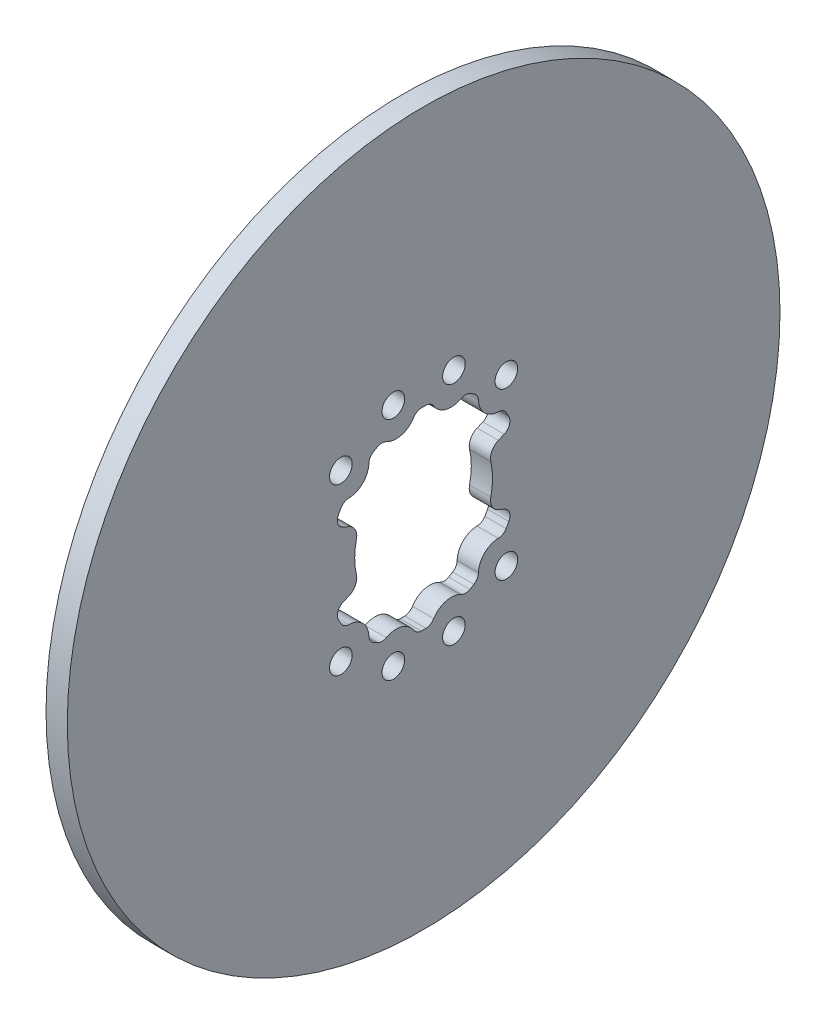
from build123d import *

# Parameters (mm, degrees)
SKETCH1_R           = 106.3625
BOSS_EXTRUDE1_DEPTH = 6.35
SKETCH2_R           = 3.3782
CUT_EXTRUDE1_DEPTH  = 151.553264038


with BuildPart() as part:
    # Sketch1 → Boss-Extrude1 (new body)
    with BuildSketch(Plane(origin=(0, 0, 0), x_dir=(0, 0, -1), z_dir=(1, 0, 0))):
        Circle(SKETCH1_R)
    extrude(amount=BOSS_EXTRUDE1_DEPTH)

    # Sketch2 → Cut-Extrude1 (cut, through all)
    with BuildSketch(Plane(origin=(6.35, 0, 0), x_dir=(0, 0, -1), z_dir=(1, 0, 0))):
        with Locations((24.695704333, -24.695704333)):
            Circle(SKETCH2_R)
        with Locations((9.03925515, -33.734959483)):
            Circle(SKETCH2_R)
        with Locations((-9.03925515, -33.734959483)):
            Circle(SKETCH2_R)
        with Locations((-24.695704333, -24.695704333)):
            Circle(SKETCH2_R)
        with Locations((-24.695704333, 24.695704333)):
            Circle(SKETCH2_R)
        with Locations((-9.03925515, 33.734959483)):
            Circle(SKETCH2_R)
        with Locations((9.03925515, 33.734959483)):
            Circle(SKETCH2_R)
        with Locations((24.695704333, 24.695704333)):
            Circle(SKETCH2_R)
        with BuildLine():
            Line((22.309989371, -8.966172555), (24.035660602, -9.680968983))
            ThreePointArc((24.035660602, -9.680968983), (25.596901419, -11.320415271), (25.431134545, -13.578241298))
            ThreePointArc((25.431134545, -13.578241298), (25.029758681, -14.304629369), (24.607640645, -15.019163188))
            ThreePointArc((24.607640645, -15.019163188), (23.62126299, -15.982367595), (22.294378957, -16.356643388))
            ThreePointArc((22.294378957, -16.356643388), (18.140117365, -18.140117365), (16.356643388, -22.294378957))
            ThreePointArc((16.356643388, -22.294378957), (15.982367595, -23.62126299), (15.019163188, -24.607640645))
            ThreePointArc((15.019163188, -24.607640645), (14.4145, -24.966646366), (13.801260332, -25.310797187))
            ThreePointArc((13.801260332, -25.310797187), (12.465430022, -25.651767845), (11.129176844, -25.312458173))
            ThreePointArc((11.129176844, -25.312458173), (6.639743783, -24.779861148), (3.018079217, -27.485820232))
            ThreePointArc((3.018079217, -27.485820232), (2.030504855, -28.447797617), (0.703156542, -28.82042352))
            ThreePointArc((0.703156542, -28.82042352), (0, -28.829), (-0.703156542, -28.82042352))
            ThreePointArc((-0.703156542, -28.82042352), (-2.030504855, -28.447797617), (-3.018079217, -27.485820232))
            ThreePointArc((-3.018079217, -27.485820232), (-6.639743783, -24.779861148), (-11.129176844, -25.312458173))
            ThreePointArc((-11.129176844, -25.312458173), (-12.465430022, -25.651767845), (-13.801260332, -25.310797187))
            ThreePointArc((-13.801260332, -25.310797187), (-14.4145, -24.966646366), (-15.019163188, -24.607640645))
            ThreePointArc((-15.019163188, -24.607640645), (-15.982367595, -23.62126299), (-16.356643388, -22.294378957))
            ThreePointArc((-16.356643388, -22.294378957), (-18.140117365, -18.140117365), (-22.294378957, -16.356643388))
            ThreePointArc((-22.294378957, -16.356643388), (-23.62126299, -15.982367595), (-24.607640645, -15.019163188))
            ThreePointArc((-24.607640645, -15.019163188), (-25.029758681, -14.304629369), (-25.431134545, -13.578241298))
            ThreePointArc((-25.431134545, -13.578241298), (-25.596901419, -11.320415271), (-24.035660602, -9.680968983))
            Line((-24.035660602, -9.680968983), (-22.309989371, -8.966172555))
            ThreePointArc((-22.309989371, -8.966172555), (-20.38229114, -7.193471081), (-20.054261178, -4.595224108))
            ThreePointArc((-20.054261178, -4.595224108), (-20.574, 0), (-20.054261178, 4.595224108))
            ThreePointArc((-20.054261178, 4.595224108), (-20.38229114, 7.193471081), (-22.309989371, 8.966172555))
            Line((-22.309989371, 8.966172555), (-24.035660602, 9.680968983))
            ThreePointArc((-24.035660602, 9.680968983), (-25.596901419, 11.320415271), (-25.431134545, 13.578241298))
            ThreePointArc((-25.431134545, 13.578241298), (-25.029758681, 14.304629369), (-24.607640645, 15.019163188))
            ThreePointArc((-24.607640645, 15.019163188), (-23.62126299, 15.982367595), (-22.294378957, 16.356643388))
            ThreePointArc((-22.294378957, 16.356643388), (-18.140117365, 18.140117365), (-16.356643388, 22.294378957))
            ThreePointArc((-16.356643388, 22.294378957), (-15.982367595, 23.62126299), (-15.019163188, 24.607640645))
            ThreePointArc((-15.019163188, 24.607640645), (-14.4145, 24.966646366), (-13.801260332, 25.310797187))
            ThreePointArc((-13.801260332, 25.310797187), (-12.465430022, 25.651767845), (-11.129176844, 25.312458173))
            ThreePointArc((-11.129176844, 25.312458173), (-6.639743783, 24.779861148), (-3.018079217, 27.485820232))
            ThreePointArc((-3.018079217, 27.485820232), (-2.030504855, 28.447797617), (-0.703156542, 28.82042352))
            ThreePointArc((-0.703156542, 28.82042352), (0, 28.829), (0.703156542, 28.82042352))
            ThreePointArc((0.703156542, 28.82042352), (2.030504855, 28.447797617), (3.018079217, 27.485820232))
            ThreePointArc((3.018079217, 27.485820232), (6.639743783, 24.779861148), (11.129176844, 25.312458173))
            ThreePointArc((11.129176844, 25.312458173), (12.465430022, 25.651767845), (13.801260332, 25.310797187))
            ThreePointArc((13.801260332, 25.310797187), (14.4145, 24.966646366), (15.019163188, 24.607640645))
            ThreePointArc((15.019163188, 24.607640645), (15.982367595, 23.62126299), (16.356643388, 22.294378957))
            ThreePointArc((16.356643388, 22.294378957), (18.140117365, 18.140117365), (22.294378957, 16.356643388))
            ThreePointArc((22.294378957, 16.356643388), (23.62126299, 15.982367595), (24.607640645, 15.019163188))
            ThreePointArc((24.607640645, 15.019163188), (25.029758681, 14.304629369), (25.431134545, 13.578241298))
            ThreePointArc((25.431134545, 13.578241298), (25.596901419, 11.320415271), (24.035660602, 9.680968983))
            Line((24.035660602, 9.680968983), (22.309989371, 8.966172555))
            ThreePointArc((22.309989371, 8.966172555), (20.38229114, 7.193471081), (20.054261178, 4.595224108))
            ThreePointArc((20.054261178, 4.595224108), (20.574, 0), (20.054261178, -4.595224108))
            ThreePointArc((20.054261178, -4.595224108), (20.38229114, -7.193471081), (22.309989371, -8.966172555))
        make_face()
    extrude(amount=-CUT_EXTRUDE1_DEPTH, mode=Mode.SUBTRACT)


solid = part.part
